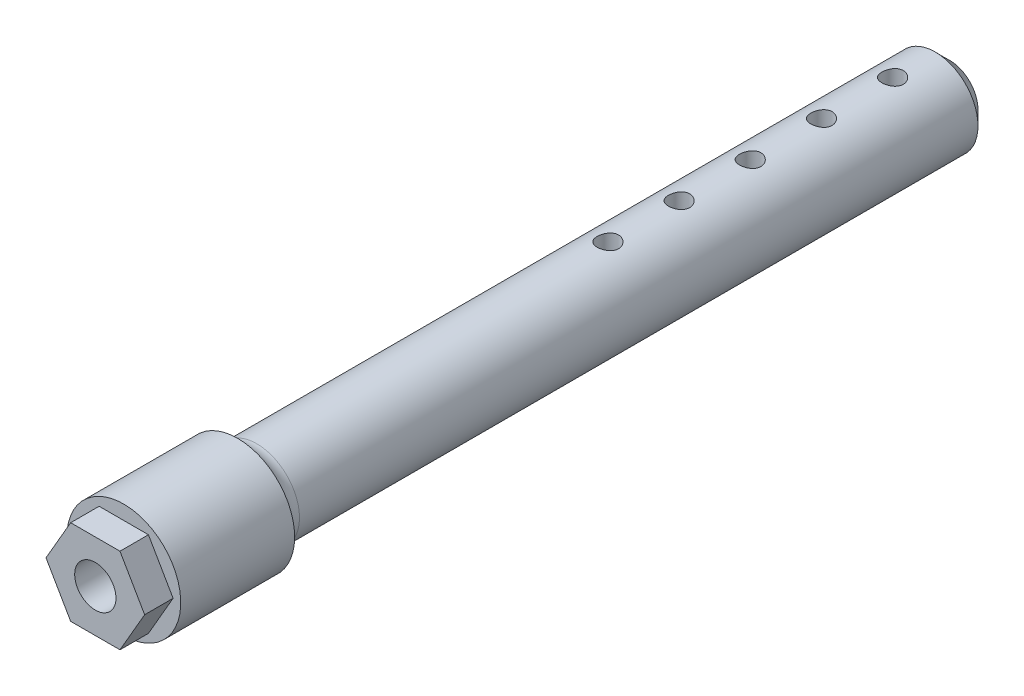
from build123d import *
from build123d.topology import SkipClean

# Parameters (mm, degrees)
SKETCH1_R               = 1.45
BOSS_EXTRUDE1_DEPTH     = 2
BOSS_EXTRUDE2_START     = 8
SKETCH2_R               = 4
SKETCH2_R_2             = 1.45
BOSS_EXTRUDE2_DEPTH     = 8
SKETCH3_R               = 3
BOSS_EXTRUDE3_DEPTH     = 50
FILLET1_R               = 1.4
CHAMFER1_SIZE           = 1
CUT_EXTRUDE1_DEPTH      = 59.275209137
CUT_EXTRUDE1_DEPTH_BACK = 59.275209137
SKETCH4_R               = 0.75


with BuildPart() as part:
    # Sketch1 → Boss-Extrude1 (new body)
    with BuildSketch(Plane.XY):
        Polygon((-3.464101615, 0), (-1.732050808, -3), (1.732050808, -3), (3.464101615, 0), (1.732050808, 3), (-1.732050808, 3), align=None)
        Circle(SKETCH1_R, mode=Mode.SUBTRACT)
    extrude(amount=BOSS_EXTRUDE1_DEPTH)

    # Sketch2 → Boss-Extrude2 (add)
    with SkipClean():  # the faces are left unmerged after this step: merging them gives an invalid solid
        with BuildSketch(Plane(origin=(0, 0, 0), x_dir=(-1, 0, 0), z_dir=(0, 0, -1)).offset(BOSS_EXTRUDE2_START)):
            Circle(SKETCH2_R)
            Circle(SKETCH2_R_2, mode=Mode.SUBTRACT)
        extrude(amount=-BOSS_EXTRUDE2_DEPTH)

    # Sketch3 → Boss-Extrude3 (add)
    with SkipClean():  # the faces are left unmerged after this step: merging them gives an invalid solid
        with BuildSketch(Plane(origin=(0, 0, -8), x_dir=(-1, 0, 0), z_dir=(0, 0, -1))):
            Circle(SKETCH3_R)
        extrude(amount=BOSS_EXTRUDE3_DEPTH)

    # Fillet1
    # the kernel refuses this fillet: 1.4 mm, written as the material it adds along each edge
    with BuildSketch(Plane(origin=(0, 0, -8), x_dir=(-1, 0, 0), z_dir=(0, -1, 0))) as fillet1_piece_1:
        with BuildLine():
            CenterArc((4.4, 1.341640786), FILLET1_R, 180, 73.398450401)
            Line((3, 1.341640786), (2.972, 1.341640786))
            Line((2.972, 1.341640786), (2.972, 0))
            Line((2.972, 0), (3, -0.028))
            ThreePointArc((3, -0.028), (3.5, -0.028), (3.992, -0.026832816))
            Line((3.992, -0.026832816), (4, 0))
        make_face()
    revolve(axis=Axis((0, 0, -8), (0, 0, -1)))
    with BuildSketch(Plane(origin=(0, 0, -8), x_dir=(-1, 0, 0), z_dir=(0, -1, 0))) as fillet1_piece_2:
        with BuildLine():
            CenterArc((1.45 - FILLET1_R, -FILLET1_R), FILLET1_R, 0, 90)
            Line((1.45 - FILLET1_R, 0), (1.45 - FILLET1_R, FILLET1_R * 0.02))
            Line((1.45 - FILLET1_R, FILLET1_R * 0.02), (1.45 + FILLET1_R * 0.02, FILLET1_R * 0.02))
            Line((1.45 + FILLET1_R * 0.02, FILLET1_R * 0.02), (1.45 + FILLET1_R * 0.02, -FILLET1_R))
            Line((1.45 + FILLET1_R * 0.02, -FILLET1_R), (1.45, -FILLET1_R))
        make_face()
    revolve(axis=Axis((0, 0, -8), (0, 0, -1)))

    # Chamfer1
    chamfer1_edges = [part.edges().sort_by_distance(p)[0] for p in [
        (3, 0, -58),
    ]]
    chamfer(chamfer1_edges, length=CHAMFER1_SIZE)

    # Sketch4 → Cut-Extrude1 (cut, two sides: drawn at the far end of the back side and taken through both)
    with BuildSketch(Plane(origin=(0, 0, 0), x_dir=(1, 0, 0), z_dir=(0, 1, 0)).offset(-CUT_EXTRUDE1_DEPTH_BACK)):
        with Locations(Location((0, 54, 0), (0, 0, 270))):
            Circle(SKETCH4_R)
        with Locations(Location((0, 49, 0), (0, 0, 270))):
            Circle(SKETCH4_R)
        with Locations(Location((0, 44, 0), (0, 0, 270))):
            Circle(SKETCH4_R)
        with Locations(Location((0, 39, 0), (0, 0, 270))):
            Circle(SKETCH4_R)
        with Locations(Location((0, 34, 0), (0, 0, 270))):
            Circle(SKETCH4_R)
    extrude(amount=CUT_EXTRUDE1_DEPTH + CUT_EXTRUDE1_DEPTH_BACK, mode=Mode.SUBTRACT)


solid = part.part
